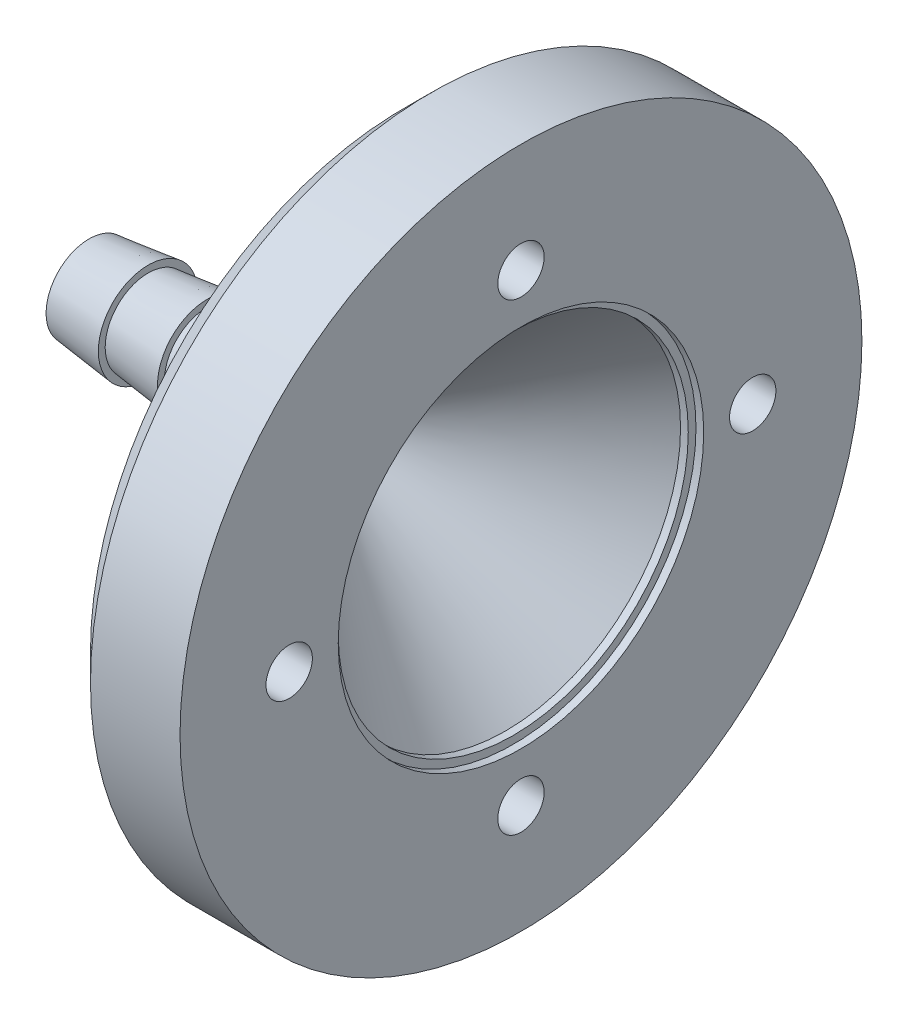
from build123d import *

# Parameters (mm, degrees)
CBORE_FOR_M3_HEX_SOCKET_HEAD_CAP_SCREW2_D           = 3.4
CBORE_FOR_M3_HEX_SOCKET_HEAD_CAP_SCREW2_DEPTH       = 8.566
CBORE_FOR_M3_HEX_SOCKET_HEAD_CAP_SCREW2_CBORE_D     = 6.5
CBORE_FOR_M3_HEX_SOCKET_HEAD_CAP_SCREW2_CBORE_DEPTH = 3.4
CBORE_FOR_M3_HEX_SOCKET_HEAD_CAP_SCREW2_TIP         = 1.021463052
CHAMFER1_SIZE                                       = 2


with BuildPart() as part:
    # Sketch1 → Revolve17 (revolve)
    with BuildSketch(Plane.XY):
        Polygon((-14.175209939, 3.65), (-14.175209939, 3.15), (-9.841876606, 3.65), (-9.841876606, 3.15), (-5.508543272, 3.65), (4.596253634, 12.834), (4.596253634, 25), (13.162253634, 25), (13.162253634, 13.4), (12.596253634, 13.4), (12.596253634, 12.834), (12.030253634, 12.834), (0, 1.9), (-18.508543272, 1.9), (-18.508543272, 3.15), align=None)
    revolve(axis=Axis((-801.920554309, 0, 0), (1, 0, 0)))

    # CBORE for M3 Hex Socket Head Cap Screw2
    with Locations(Plane.ZY.offset(-4.596253634)):
        with Locations((0, -16.994664238), (0, 16.994664238), (16.994664238, 0), (-16.994664238, 0)):
            CounterBoreHole(CBORE_FOR_M3_HEX_SOCKET_HEAD_CAP_SCREW2_D / 2, CBORE_FOR_M3_HEX_SOCKET_HEAD_CAP_SCREW2_CBORE_D / 2, CBORE_FOR_M3_HEX_SOCKET_HEAD_CAP_SCREW2_CBORE_DEPTH, depth=CBORE_FOR_M3_HEX_SOCKET_HEAD_CAP_SCREW2_DEPTH)
            with Locations((0, 0, -(CBORE_FOR_M3_HEX_SOCKET_HEAD_CAP_SCREW2_DEPTH + CBORE_FOR_M3_HEX_SOCKET_HEAD_CAP_SCREW2_TIP / 2))):  # 118° drill point
                Cone(0, CBORE_FOR_M3_HEX_SOCKET_HEAD_CAP_SCREW2_D / 2, CBORE_FOR_M3_HEX_SOCKET_HEAD_CAP_SCREW2_TIP, mode=Mode.SUBTRACT)

    # Chamfer1
    chamfer1_edges = [part.edges().sort_by_distance(p)[0] for p in [
        (4.596253634, -25, 0),
    ]]
    chamfer(chamfer1_edges, length=CHAMFER1_SIZE)


solid = part.part
